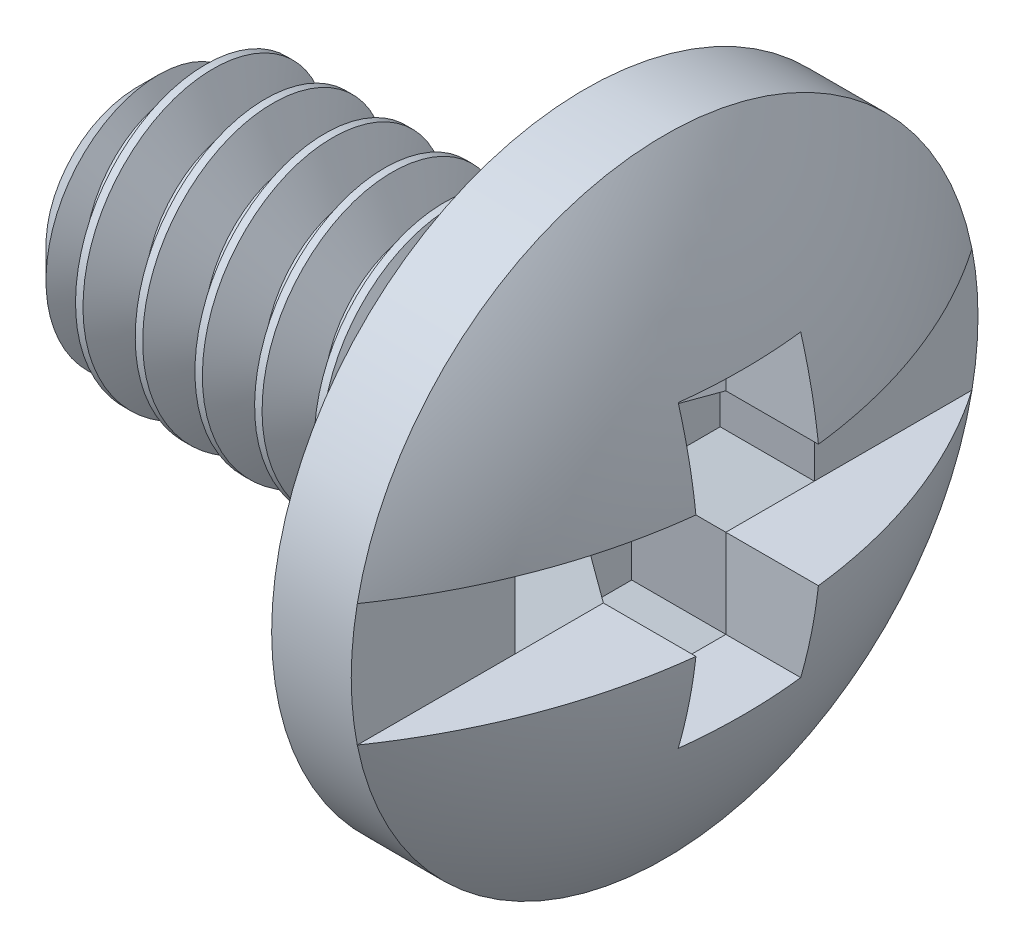
from build123d import *

# Parameters (mm, degrees)
SKETCH2_R                    = 2.413
BOSS_EXTRUDE1_DEPTH          = 7.9375
CHAMFER1_SIZE                = 0.79375
CUT_SWEEP1_PITCH             = 1.058333333
SKETCH17_W                   = 11.1125
SKETCH17_H                   = 2.1717
CUT_EXTRUDE5_DEPTH           = 1.763889
SKETCH18_W                   = 2.1717
SKETCH18_H                   = 5.3086
CUT_EXTRUDE6_DEPTH           = 13.21230362
CUT_EXTRUDE6_OTHER_WAY_DEPTH = 1.058333
CUT_EXTRUDE6_OTHER_WAY_TAPER = 30
SKETCH19_W                   = 5.3086
SKETCH19_H                   = 2.1717
CUT_EXTRUDE7_DEPTH           = 1.058333
CUT_EXTRUDE7_DRAFT           = -30


with BuildPart() as part:
    # Sketch2 → Boss-Extrude1 (new body)
    with BuildSketch(Plane(origin=(0, 0, 0), x_dir=(0, 0, -1), z_dir=(1, 0, 0))):
        Circle(SKETCH2_R)
    extrude(amount=BOSS_EXTRUDE1_DEPTH)

    # Chamfer1
    chamfer1_edges = [part.edges().sort_by_distance(p)[0] for p in [
        (0, 0, 2.413),
    ]]
    chamfer(chamfer1_edges, length=CHAMFER1_SIZE)

    # Cut-Sweep1: the profile of Sketch5 profile screwed along a right-hand helix of 8.5 turns, 8 arcs to a turn; built about Z, then put on its axis
    cut_sweep1_z = Axis((0, 0, 0), (0, 0, 1))
    cut_sweep1_corners = [(2.4133, 0, 0.000173205), (2.4133, 0, -0.926214872), (1.725592336, 0, -0.529166667), (1.725592336, 0, -0.396875)]
    with BuildLine(mode=Mode.PRIVATE) as cut_sweep1_profile:
        Line(cut_sweep1_corners[0], cut_sweep1_corners[1])
        Line(cut_sweep1_corners[1], cut_sweep1_corners[2])
        Line(cut_sweep1_corners[2], cut_sweep1_corners[3])
        Line(cut_sweep1_corners[3], cut_sweep1_corners[0])
    cut_sweep1_cap = Face(cut_sweep1_profile.wire())
    cut_sweep1_turn_angles = [0, 22.5, 45, 67.5, 90, 112.5, 135, 157.5, 180, 202.5, 225, 247.5, 270, 292.5, 315, 337.5, 360]
    cut_sweep1_turn_weights = [1, 0.9238795325112867, 1, 0.9238795325112867, 1, 0.9238795325112867, 1, 0.9238795325112867, 1, 0.9238795325112867, 1, 0.9238795325112867, 1, 0.9238795325112867, 1, 0.9238795325112867, 1]
    cut_sweep1_turn_rails = [Edge.make_bspline([Vector(p[0], p[1], 0).rotate(cut_sweep1_z, cut_sweep1_turn_angles[k]) / cut_sweep1_turn_weights[k] + Vector(0, 0, p[2] + CUT_SWEEP1_PITCH * cut_sweep1_turn_angles[k] / 360) for k in range(17)], [0, 0, 0, 1, 1, 2, 2, 3, 3, 4, 4, 5, 5, 6, 6, 7, 7, 8, 8, 8], 2, cut_sweep1_turn_weights) for p in cut_sweep1_corners]
    cut_sweep1_turn_sides = [Face.make_surface_from_curves(cut_sweep1_turn_rails[p[0]], cut_sweep1_turn_rails[p[1]]) for p in [(0, 1), (1, 2), (2, 3), (3, 0)]]
    cut_sweep1_last_angles = [2880, 2902.5, 2925, 2947.5, 2970, 2992.5, 3015, 3037.5, 3060]
    cut_sweep1_last_weights = [1, 0.9238795325112867, 1, 0.9238795325112867, 1, 0.9238795325112867, 1, 0.9238795325112822, 1]
    cut_sweep1_last_rails = [Edge.make_bspline([Vector(p[0], p[1], 0).rotate(cut_sweep1_z, cut_sweep1_last_angles[k]) / cut_sweep1_last_weights[k] + Vector(0, 0, p[2] + CUT_SWEEP1_PITCH * cut_sweep1_last_angles[k] / 360) for k in range(9)], [0, 0, 0, 1, 1, 2, 2, 3, 3, 4, 4, 4], 2, cut_sweep1_last_weights) for p in cut_sweep1_corners]
    cut_sweep1_last_sides = [Face.make_surface_from_curves(cut_sweep1_last_rails[p[0]], cut_sweep1_last_rails[p[1]]) for p in [(0, 1), (1, 2), (2, 3), (3, 0)]]
    cut_sweep1 = Plane(origin=(0, 0, 0), x_dir=(0, 1, 0), z_dir=(1, 0, 0)) * Solid(Shell([*[p.moved(Location((0, 0, CUT_SWEEP1_PITCH * i))) for i in range(8) for p in cut_sweep1_turn_sides], *cut_sweep1_last_sides, cut_sweep1_cap, cut_sweep1_cap.rotate(cut_sweep1_z, 3060).moved(Location((0, 0, CUT_SWEEP1_PITCH * 3060 / 360)))]))
    add(cut_sweep1, mode=Mode.SUBTRACT)


with BuildPart() as body_2:
    # Sketch6 → Revolve1 (revolve)
    with BuildSketch(Plane.XY):
        with BuildLine():
            Line((7.9375, 0), (7.9375, 5.55625))
            Line((7.9375, 5.55625), (9.348611111, 5.55625))
            ThreePointArc((9.348611111, 5.55625), (10.660944275, 2.91475634), (11.1125, 0))
            Line((11.1125, 0), (7.9375, 0))
        make_face()
    revolve(axis=Axis((7.9375, 0, 0), (1, 0, 0)))

    # Sketch17 → Cut-Extrude5 (cut)
    with BuildSketch(Plane(origin=(11.1125, 0, 0), x_dir=(0, 0, -1), z_dir=(1, 0, 0))):
        Rectangle(SKETCH17_W, SKETCH17_H)
    extrude(amount=-CUT_EXTRUDE5_DEPTH, mode=Mode.SUBTRACT)

    # Sketch18 → Cut-Extrude6 (cut)
    with BuildSketch(Plane(origin=(9.348611111, 0, 0), x_dir=(0, 0, -1), z_dir=(1, 0, 0))):
        Rectangle(SKETCH18_W, SKETCH18_H)
    extrude(amount=CUT_EXTRUDE6_DEPTH, mode=Mode.SUBTRACT)

    # Sketch18 → Cut-Extrude6 other way (cut)
    with BuildSketch(Plane(origin=(9.348611111, 0, 0), x_dir=(0, 0, -1), z_dir=(1, 0, 0))):
        Rectangle(SKETCH18_W, SKETCH18_H)
    extrude(amount=-CUT_EXTRUDE6_OTHER_WAY_DEPTH, taper=CUT_EXTRUDE6_OTHER_WAY_TAPER, mode=Mode.SUBTRACT)


with BuildPart() as cut_extrude7_tool:
    # Sketch19 → Cut-Extrude7 (with draft: the straight prism first)
    with BuildSketch(Plane(origin=(9.348611111, 0, 0), x_dir=(0, 0, -1), z_dir=(1, 0, 0))):
        Rectangle(SKETCH19_W, SKETCH19_H)
    extrude(amount=-CUT_EXTRUDE7_DEPTH)
    # Cut-Extrude7: the draft: its side faces are tilted about the plane it starts from
    cut_extrude7_sides = [cut_extrude7_tool.faces().sort_by_distance(p)[0] for p in [
        (8.819444611, 0, 2.6543),
        (8.819444611, -1.08585, 0),
        (8.819444611, 0, -2.6543),
        (8.819444611, 1.08585, 0),
    ]]
    draft(cut_extrude7_sides, Plane(origin=(9.348611111, 0, 0), x_dir=(0, 0, -1), z_dir=(1, 0, 0)), CUT_EXTRUDE7_DRAFT)


with BuildPart() as body_2_1:
    add(body_2.part)

    # Cut-Extrude7: cut by cut_extrude7_tool
    add(cut_extrude7_tool.part, mode=Mode.SUBTRACT)


solid = Compound([part.part, body_2_1.part])
